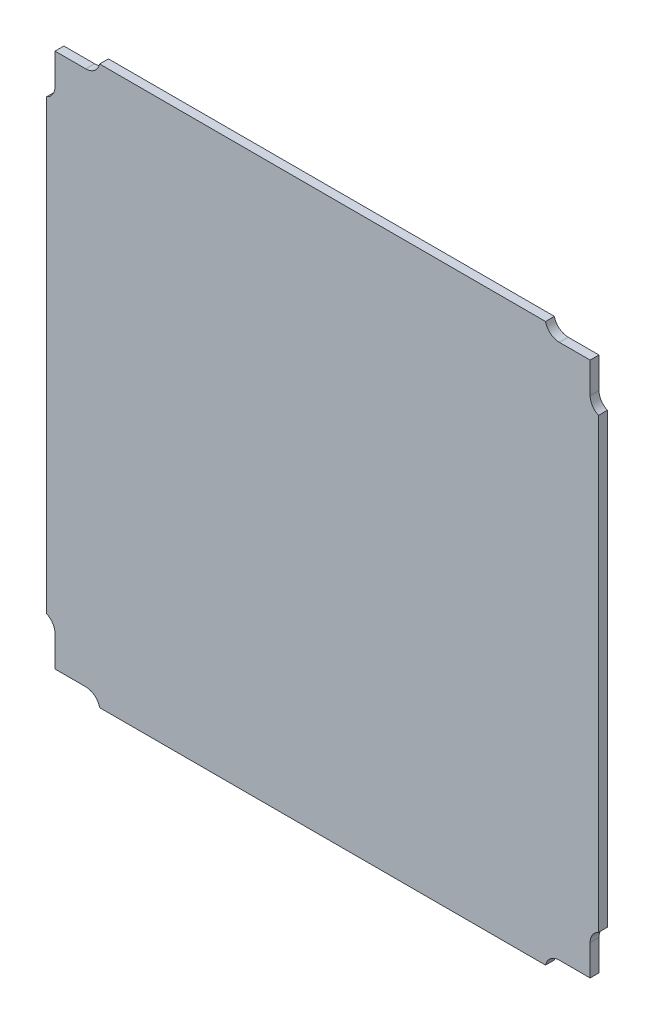
from build123d import *

# Parameters (mm, degrees)
BOSS_EXTRUDE1_DEPTH = 1.5875
FILLET1_R           = 2.54
SKETCH6_OUTSIDE_W   = 130.286
SKETCH6_OUTSIDE_H   = 130.286
SKETCH6_OUTSIDE_W_2 = 99
SKETCH6_OUTSIDE_H_2 = 100
CUT_EXTRUDE2_DEPTH  = 71.728496069


with BuildPart() as part:
    # Sketch1 → Boss-Extrude1 (new body)
    with BuildSketch(Plane.XY):
        Polygon((40, 50), (-40, 50), (-40, 48), (-48, 48), (-48, 40), (-50, 40), (-50, -37.864895224), (-50, -40), (-48, -40), (-48, -48), (-40, -48), (-40, -50), (-37.864895224, -50), (40, -50), (40, -48), (48, -48), (48, -40), (50, -40), (50, 40), (48, 40), (48, 48), (40, 48), align=None)
    extrude(amount=BOSS_EXTRUDE1_DEPTH)

    # Fillet1
    # the kernel refuses this fillet: 2.54 mm, written as the material it adds along each edge
    with BuildSketch(Plane(origin=(-48, -40, 0), x_dir=(0, -1, 0), z_dir=(0, 0, 1)), Plane(origin=(40, -48, 0), x_dir=(1, 0, 0), z_dir=(0, 0, 1)), Plane(origin=(48, 40, 0), x_dir=(0, 1, 0), z_dir=(0, 0, 1)), Plane(origin=(-40, 48, 0), x_dir=(-1, 0, 0), z_dir=(0, 0, 1))) as fillet1_piece_1:
        with BuildLine():
            CenterArc((2.481934729, -2.54), FILLET1_R, 90, 77.725329785)
            Line((0, -2), (-0.049638695, -1.9892))
            ThreePointArc((-0.049638695, -1.9892), (-0.0508, -1), (-0.0508, 0))
            Line((-0.0508, 0), (0, 0.0508))
            Line((0, 0.0508), (2.481934729, 0.0508))
            Line((2.481934729, 0.0508), (2.481934729, 0))
        make_face()
    extrude(amount=1.5875)
    with BuildSketch(Plane(origin=(-40, -48, 0), x_dir=(-3.737454790095179e-12, -1.0, 0), z_dir=(0, 0, 1)), Plane(origin=(48, -40, 0), x_dir=(1.0, -3.7339020764163554e-12, 0), z_dir=(0, 0, 1)), Plane(origin=(-48, 40, 0), x_dir=(-1.0, 3.737454790095126e-12, 0), z_dir=(0, 0, 1))) as fillet1_piece_2:
        with BuildLine():
            CenterArc((2.54, -2.481934729), FILLET1_R, 102.274670215, 77.725329785)
            Line((0, -2.481934729), (-0.0508, -2.481934729))
            Line((-0.0508, -2.481934729), (-0.0508, 0))
            Line((-0.0508, 0), (0, 0.0508))
            ThreePointArc((0, 0.0508), (1, 0.0508), (1.9892, 0.049638695))
            Line((1.9892, 0.049638695), (2, 0))
        make_face()
    extrude(amount=1.5875)
    with BuildSketch(Plane(origin=(40, 48, 0), x_dir=(1, 0, 0), z_dir=(0, 0, 1))) as fillet1_piece_3:
        with BuildLine():
            CenterArc((2.481934729, 2.54), FILLET1_R, 192.274670215, 77.725329785)
            Line((0, 2), (-0.049638695, 1.9892))
            ThreePointArc((-0.049638695, 1.9892), (-0.0508, 1), (-0.0508, 0))
            Line((-0.0508, 0), (0, -0.0508))
            Line((0, -0.0508), (2.481934729, -0.0508))
            Line((2.481934729, -0.0508), (2.481934729, 0))
        make_face()
    extrude(amount=1.5875)

    # Sketch6 outside → Cut-Extrude2 (cut, through all)
    with BuildSketch(Plane.XY.offset(1.5875)):
        Rectangle(SKETCH6_OUTSIDE_W, SKETCH6_OUTSIDE_H)
        Rectangle(SKETCH6_OUTSIDE_W_2, SKETCH6_OUTSIDE_H_2, mode=Mode.SUBTRACT)
    extrude(amount=-CUT_EXTRUDE2_DEPTH, mode=Mode.SUBTRACT)


solid = part.part
